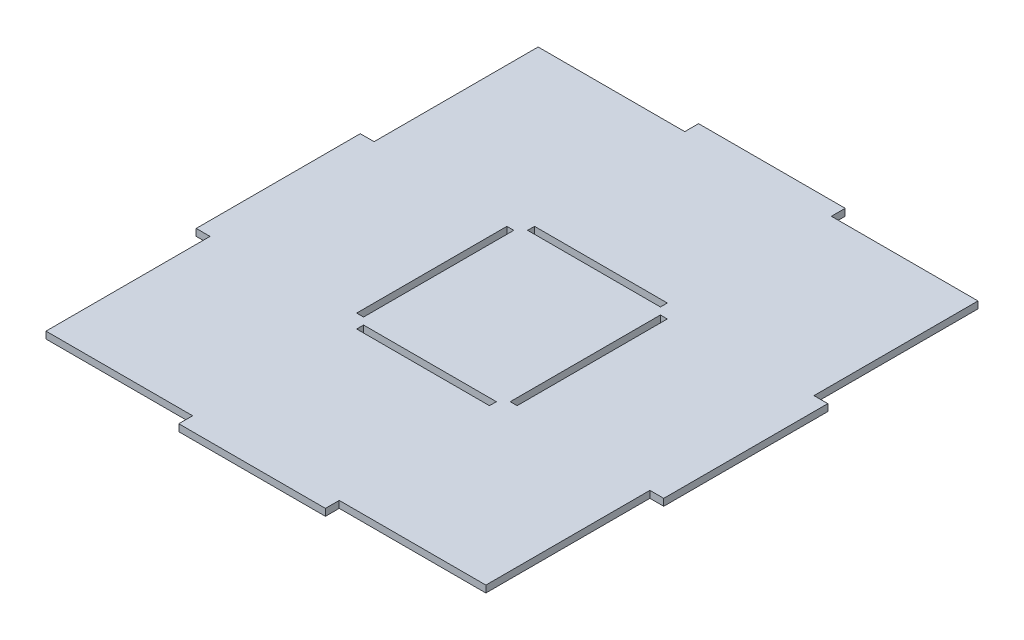
from build123d import *

# Parameters (mm, degrees)
SKETCH1_W                 = 6.35
SKETCH1_H                 = 37.666666667
SKETCH1_W_2               = 33.666666667
SKETCH1_H_2               = 6.35
BOSS_EXTRUDE1_DEPTH       = 3.175
MIRROR1_START             = -101
MIRROR1_OUTLINE_W         = 3.175
MIRROR1_OUTLINE_H         = 3.175
MIRROR1_OUTLINE_H_2       = 72.158333333
MIRROR1_DEPTH             = 101
MIRROR1_START_2           = -107.35
MIRROR1_2_OUTLINE_W       = 3.175
MIRROR1_2_OUTLINE_H       = 37.666666667
MIRROR1_2_DEPTH           = 70.508333333
MIRROR1_START_3           = -33.666666667
MIRROR1_3_OUTLINE_W       = 3.175
MIRROR1_3_OUTLINE_H       = 34.491666667
MIRROR1_3_OUTLINE_H_2     = 6.35
MIRROR1_3_DEPTH           = 33.666666667
MIRROR1_4_OUTLINE_W       = 3.175
MIRROR1_4_OUTLINE_H       = 3.175
MIRROR1_4_DEPTH           = 70.508333333
MIRROR4_COPY_1_SKETCH_W   = 6.35
MIRROR4_COPY_1_SKETCH_H   = 37.666666667
MIRROR4_COPY_1_SKETCH_W_2 = 33.666666667
MIRROR4_COPY_1_SKETCH_H_2 = 6.35
MIRROR4_COPY_1_DEPTH      = 3.175
MIRROR4_COPY_2_SKETCH_W   = 6.35
MIRROR4_COPY_2_SKETCH_H   = 37.666666667
MIRROR4_COPY_2_SKETCH_W_2 = 33.666666667
MIRROR4_COPY_2_SKETCH_H_2 = 6.35
MIRROR4_COPY_2_DEPTH      = 3.175


# Read off the part's stored shape, not the designer's step: Mirror1
with BuildPart() as part:
    # Sketch1 → Boss-Extrude1 (new body)
    with BuildSketch(Plane(origin=(0, 0, 0), x_dir=(1, 0, 0), z_dir=(0, 1, 0))):
        Polygon((-33.666666667, 113), (-101, 113), (-101, 37.666666667), (-101, 0), (-36.841666667, 0), (-36.841666667, 34.491666667), (-33.666666667, 34.491666667), (-33.666666667, 0), (0, 0), (0, 37.666666667), (-30.491666667, 37.666666667), (-30.491666667, 40.841666667), (0, 40.841666667), (0, 113), align=None)
        with Locations((-104.175, 18.833333334)):
            Rectangle(SKETCH1_W, SKETCH1_H)
        with Locations((-16.833333334, 116.175)):
            Rectangle(SKETCH1_W_2, SKETCH1_H_2)
    boss_extrude1 = extrude(amount=BOSS_EXTRUDE1_DEPTH)



with BuildPart() as body_2:
    # Mirror1 outline → Mirror1 (new body)
    with BuildSketch(Plane.YZ.offset(MIRROR1_START)):
        with Locations((1.5875, 36.079166667)):
            Rectangle(MIRROR1_OUTLINE_W, MIRROR1_OUTLINE_H)
        with Locations((1.5875, 76.920833333)):
            Rectangle(MIRROR1_OUTLINE_W, MIRROR1_OUTLINE_H_2)
    extrude(amount=MIRROR1_DEPTH)


with BuildPart() as part_1:
    add(part.part)

    add(body_2.part)  # Mirror1 2 merges body 2
    # Mirror1 2 outline → Mirror1 2 (add)
    with BuildSketch(Plane.YZ.offset(MIRROR1_START_2)):
        with Locations((1.5875, 18.833333334)):
            Rectangle(MIRROR1_2_OUTLINE_W, MIRROR1_2_OUTLINE_H)
    extrude(amount=MIRROR1_2_DEPTH)

    # Mirror1 3 outline → Mirror1 3 (add)
    with BuildSketch(Plane.YZ.offset(MIRROR1_START_3)):
        with Locations((1.5875, 17.245833334)):
            Rectangle(MIRROR1_3_OUTLINE_W, MIRROR1_3_OUTLINE_H)
        with Locations((1.5875, 116.175)):
            Rectangle(MIRROR1_3_OUTLINE_W, MIRROR1_3_OUTLINE_H_2)
    extrude(amount=MIRROR1_3_DEPTH)

    # Mirror1 4 outline → Mirror1 4 (add)
    with BuildSketch(Plane.YZ.offset(MIRROR1_START)):
        with Locations((1.5875, 39.254166667)):
            Rectangle(MIRROR1_4_OUTLINE_W, MIRROR1_4_OUTLINE_H)
    extrude(amount=MIRROR1_4_DEPTH)

    # Mirror3: Boss-Extrude1 across plane
    add(boss_extrude1.mirror(Plane(origin=(0, 0, 0), x_dir=(0, 0, 1), z_dir=(1, 0, 0))))

    # Mirror4 copy 1 sketch → Mirror4 copy 1 (add)
    with BuildSketch(Plane(origin=(0, 0, 0), x_dir=(-1, 0, 0), z_dir=(0, 1, 0))):
        Polygon((-33.666666667, 113), (-101, 113), (-101, 37.666666667), (-101, 0), (-36.841666667, 0), (-36.841666667, 34.491666667), (-33.666666667, 34.491666667), (-33.666666667, 0), (0, 0), (0, 37.666666667), (-30.491666667, 37.666666667), (-30.491666667, 40.841666667), (0, 40.841666667), (0, 113), align=None)
        with Locations((-104.175, 18.833333334)):
            Rectangle(MIRROR4_COPY_1_SKETCH_W, MIRROR4_COPY_1_SKETCH_H)
        with Locations((-16.833333334, 116.175)):
            Rectangle(MIRROR4_COPY_1_SKETCH_W_2, MIRROR4_COPY_1_SKETCH_H_2)
    extrude(amount=MIRROR4_COPY_1_DEPTH)

    # Mirror4 copy 2 sketch → Mirror4 copy 2 (add)
    with BuildSketch(Plane(origin=(0, 0, 0), x_dir=(1, 0, 0), z_dir=(0, 1, 0))):
        Polygon((-33.666666667, -113), (-101, -113), (-101, -37.666666667), (-101, 0), (-36.841666667, 0), (-36.841666667, -34.491666667), (-33.666666667, -34.491666667), (-33.666666667, 0), (0, 0), (0, -37.666666667), (-30.491666667, -37.666666667), (-30.491666667, -40.841666667), (0, -40.841666667), (0, -113), align=None)
        with Locations((-104.175, -18.833333334)):
            Rectangle(MIRROR4_COPY_2_SKETCH_W, MIRROR4_COPY_2_SKETCH_H)
        with Locations((-16.833333334, -116.175)):
            Rectangle(MIRROR4_COPY_2_SKETCH_W_2, MIRROR4_COPY_2_SKETCH_H_2)
    extrude(amount=MIRROR4_COPY_2_DEPTH)


solid = part_1.part
